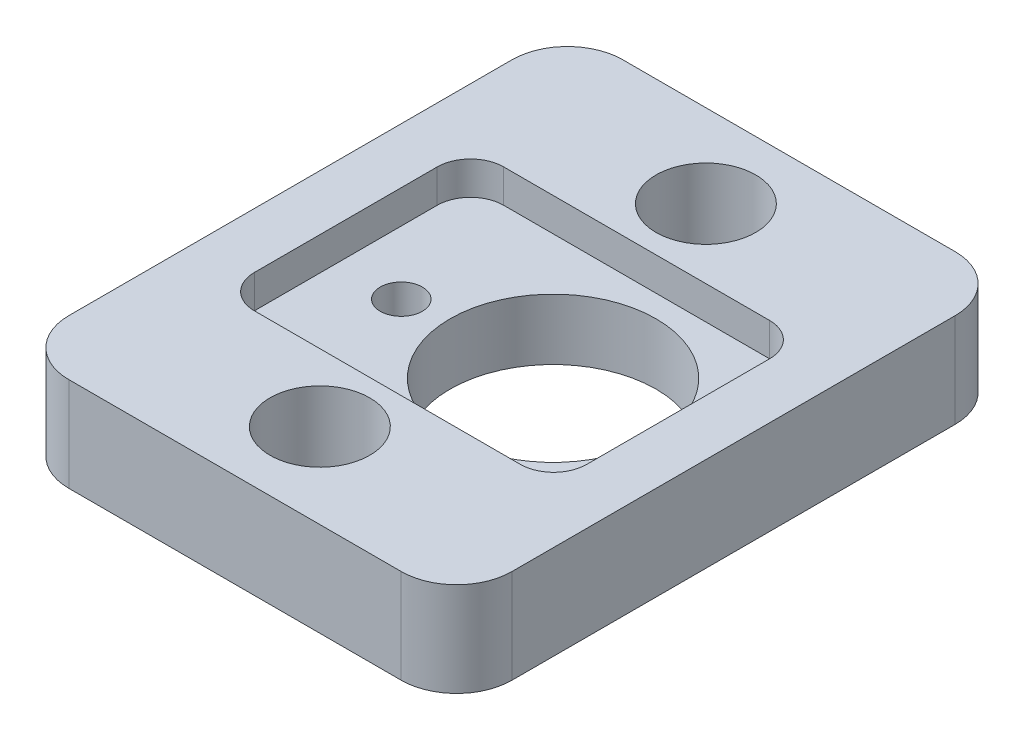
from build123d import *

# Parameters (mm, degrees)
BOSS_EXTRUDE1_DEPTH = 3.4
CUT_EXTRUDE1_DEPTH  = 1.2
SKETCH3_R           = 3.72
CUT_EXTRUDE2_DEPTH  = 26.706808437
SKETCH4_R           = 1.8
CUT_EXTRUDE3_DEPTH  = 26.837182509
SKETCH5_R           = 0.76
CUT_EXTRUDE4_DEPTH  = 10


with BuildPart() as part:
    # Sketch1 → Boss-Extrude1 (new body)
    with BuildSketch(Plane(origin=(0, 0, 0), x_dir=(1, 0, 0), z_dir=(0, 1, 0))):
        with BuildLine():
            Line((2, 0), (14, 0))
            ThreePointArc((14, 0), (15.414213562, -0.585786438), (16, -2))
            Line((16, -2), (16, -18))
            ThreePointArc((16, -18), (15.414213562, -19.414213562), (14, -20))
            Line((14, -20), (2, -20))
            ThreePointArc((2, -20), (0.585786438, -19.414213562), (0, -18))
            Line((0, -18), (0, -2))
            ThreePointArc((0, -2), (0.585786438, -0.585786438), (2, 0))
        make_face()
    extrude(amount=BOSS_EXTRUDE1_DEPTH)

    # Sketch2 → Cut-Extrude1 (cut)
    with BuildSketch(Plane(origin=(0, 3.4, 0), x_dir=(1, 0, 0), z_dir=(0, 1, 0))):
        with BuildLine():
            Line((3.2, -5.5), (12.8, -5.5))
            ThreePointArc((12.8, -5.5), (13.648528137, -5.851471863), (14, -6.7))
            Line((14, -6.7), (14, -13.3))
            ThreePointArc((14, -13.3), (13.648528137, -14.148528137), (12.8, -14.5))
            Line((12.8, -14.5), (3.2, -14.5))
            ThreePointArc((3.2, -14.5), (2.351471863, -14.148528137), (2, -13.3))
            Line((2, -13.3), (2, -6.7))
            ThreePointArc((2, -6.7), (2.351471863, -5.851471863), (3.2, -5.5))
        make_face()
    extrude(amount=-CUT_EXTRUDE1_DEPTH, mode=Mode.SUBTRACT)

    # Sketch3 → Cut-Extrude2 (cut, through all)
    with BuildSketch(Plane(origin=(0, 2.2, 0), x_dir=(1, 0, 0), z_dir=(0, 1, 0))):
        with Locations((9.5, -10.0173545)):
            Circle(SKETCH3_R)
    extrude(amount=-CUT_EXTRUDE2_DEPTH, mode=Mode.SUBTRACT)

    # Sketch4 → Cut-Extrude3 (cut, through all)
    with BuildSketch(Plane(origin=(0, 3.4, 0), x_dir=(1, 0, 0), z_dir=(0, 1, 0))):
        with Locations((8, -3)):
            Circle(SKETCH4_R)
        with Locations((8, -16.936566923)):
            Circle(SKETCH4_R)
    extrude(amount=-CUT_EXTRUDE3_DEPTH, mode=Mode.SUBTRACT)

    # Sketch5 → Cut-Extrude4 (cut)
    with BuildSketch(Plane(origin=(0, 2.2, 0), x_dir=(1, 0, 0), z_dir=(0, 1, 0))):
        with Locations((4.286808808, -10.283883288)):
            Circle(SKETCH5_R)
    extrude(amount=-CUT_EXTRUDE4_DEPTH, mode=Mode.SUBTRACT)


solid = part.part
